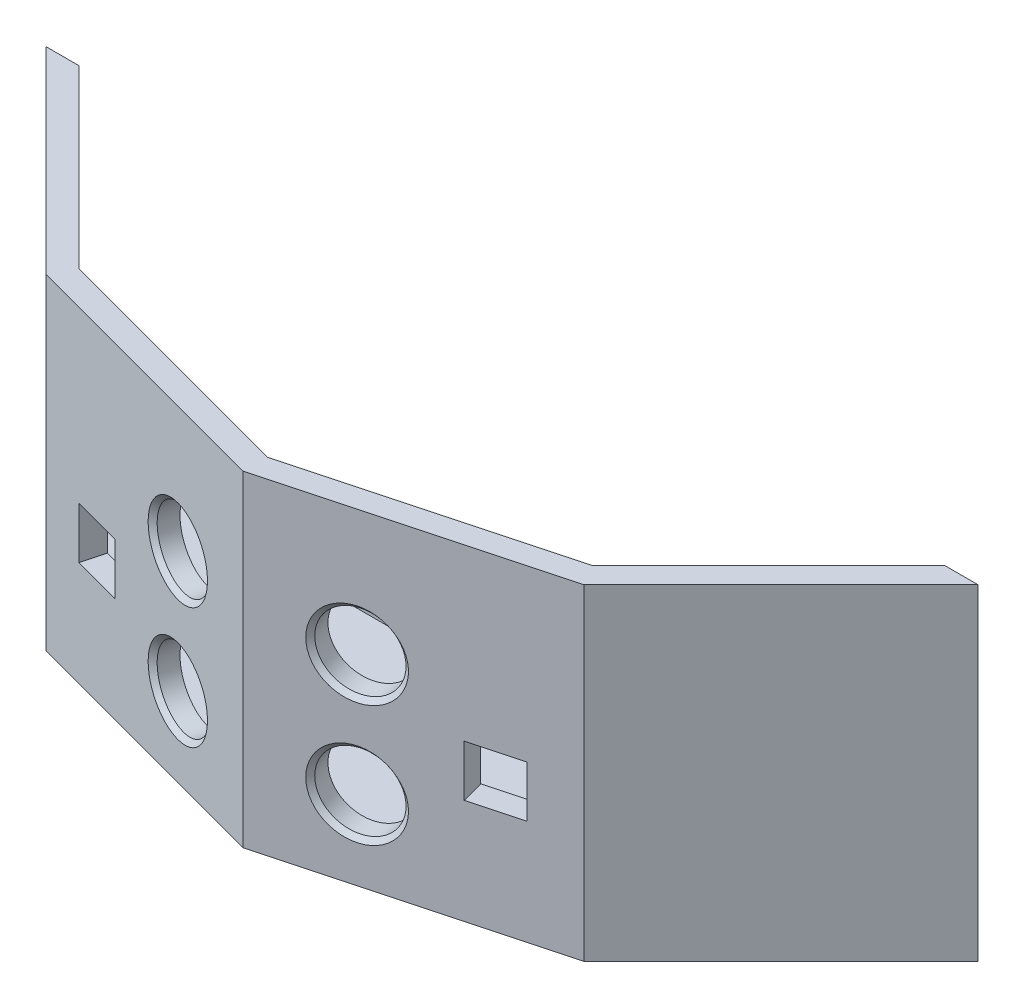
from build123d import *

# Parameters (mm, degrees)
BOSS_EXTRUDE1_DEPTH = 70
CUT_EXTRUDE1_DEPTH  = 65
SKETCH5_R           = 8
CUT_EXTRUDE2_DEPTH  = 10
SKETCH6_R           = 8
CUT_EXTRUDE3_DEPTH  = 10
CHAMFER2_SIZE       = 1
SKETCH7_W           = 11
SKETCH7_H           = 11
CUT_EXTRUDE4_DEPTH  = 10
SKETCH8_W           = 11
SKETCH8_H           = 11
CUT_EXTRUDE5_DEPTH  = 10
SKETCH9_W           = 13
SKETCH9_H           = 10
BOSS_EXTRUDE2_DEPTH = 6
SKETCH10_R          = 2
CUT_EXTRUDE6_DEPTH  = 10
FILLET1_R           = 5


with BuildPart() as part:
    # Sketch1 → Boss-Extrude1 (new body)
    with BuildSketch(Plane(origin=(0, 0, 0), x_dir=(1, 0, 0), z_dir=(0, 1, 0))):
        Polygon((57.735026919, -100), (100, -57.735026919), (-100, -57.735026919), (-57.735026919, -100), (0, -115.470053838), align=None)
    extrude(amount=BOSS_EXTRUDE1_DEPTH)

    # Sketch4 → Cut-Extrude1 (cut)
    with BuildSketch(Plane(origin=(0, 70, 0), x_dir=(1, 0, 0), z_dir=(0, 1, 0))):
        Polygon((110.293672936, 0), (95.517122639, 55.146836468), (55.146836468, 95.517122639), (0, 110.293672936), (-55.146836468, 95.517122639), (-95.517122639, 55.146836468), (-110.293672936, 0), (-95.517122639, -55.146836468), (-55.146836468, -95.517122639), (0, -110.293672936), (55.146836468, -95.517122639), (95.517122639, -55.146836468), align=None)
    extrude(amount=-CUT_EXTRUDE1_DEPTH, mode=Mode.SUBTRACT)

    # Sketch5 → Cut-Extrude2 (cut)
    with BuildSketch(Plane(origin=(-28.867513459, 0, 107.735026919), x_dir=(0.9659258262890683, 0, 0.25881904510252085), z_dir=(-0.2588190451025208, 0, 0.9659258262890682))):
        with Locations((10.114150928, 43)):
            Circle(SKETCH5_R)
        with Locations((10.114150928, 17)):
            Circle(SKETCH5_R)
    extrude(amount=-CUT_EXTRUDE2_DEPTH, mode=Mode.SUBTRACT)

    # Sketch6 → Cut-Extrude3 (cut)
    with BuildSketch(Plane(origin=(28.867513459, 0, 107.735026919), x_dir=(0.9659258262890683, 0, -0.25881904510252085), z_dir=(0.2588190451025208, 0, 0.9659258262890682))):
        with Locations((-9.885849072, 17)):
            Circle(SKETCH6_R)
        with Locations((-9.885849072, 43)):
            Circle(SKETCH6_R)
    extrude(amount=-CUT_EXTRUDE3_DEPTH, mode=Mode.SUBTRACT)

    # Chamfer2
    chamfer2_edges = [part.edges().sort_by_distance(p)[0] for p in [
        (-26.825400478, 43, 108.282209443),
        (-26.825400478, 17, 108.282209443),
        (11.591109915, 17, 112.364225297),
        (11.591109915, 43, 112.364225297),
    ]]
    chamfer(chamfer2_edges, length=CHAMFER2_SIZE)

    # Sketch7 → Cut-Extrude4 (cut)
    with BuildSketch(Plane(origin=(-28.867513459, 0, 107.735026919), x_dir=(0.9659258262890683, 0, 0.25881904510252085), z_dir=(-0.2588190451025208, 0, 0.9659258262890682))):
        with Locations((-14.385849072, 28)):
            Rectangle(SKETCH7_W, SKETCH7_H)
    extrude(amount=-CUT_EXTRUDE4_DEPTH, mode=Mode.SUBTRACT)

    # Sketch8 → Cut-Extrude5 (cut)
    with BuildSketch(Plane(origin=(28.867513459, 0, 107.735026919), x_dir=(0.9659258262890683, 0, -0.25881904510252085), z_dir=(0.2588190451025208, 0, 0.9659258262890682))):
        with Locations((14.385849072, 28)):
            Rectangle(SKETCH8_W, SKETCH8_H)
    extrude(amount=-CUT_EXTRUDE5_DEPTH, mode=Mode.SUBTRACT)

    # Sketch9 → Boss-Extrude2 (add)
    with BuildSketch(Plane(origin=(0, 0, 57.735026919), x_dir=(-1, 0, 0), z_dir=(0, 0, -1))):
        with Locations((-26.5, 10)):
            Rectangle(SKETCH9_W, SKETCH9_H)
        with Locations((26.5, 10)):
            Rectangle(SKETCH9_W, SKETCH9_H)
    extrude(amount=-BOSS_EXTRUDE2_DEPTH)

    # Sketch10 → Cut-Extrude6 (cut)
    with BuildSketch(Plane(origin=(0, 0, 57.735026919), x_dir=(-1, 0, 0), z_dir=(0, 0, -1))):
        with Locations((-26.5, 11)):
            Circle(SKETCH10_R)
        with Locations((26.5, 11)):
            Circle(SKETCH10_R)
    extrude(amount=-CUT_EXTRUDE6_DEPTH, mode=Mode.SUBTRACT)

    # Fillet1
    fillet1_edges = [part.edges().sort_by_distance(p)[0] for p in [
        (-33, 5, 60.735026919),
        (-20, 5, 60.735026919),
        (20, 5, 60.735026919),
        (33, 5, 60.735026919),
    ]]
    fillet(fillet1_edges, radius=FILLET1_R)
    fillet1_2_edges = [part.edges().sort_by_distance(p)[0] for p in [
        (-33, 15, 60.735026919),
        (-20, 15, 60.735026919),
        (20, 15, 60.735026919),
        (33, 15, 60.735026919),
    ]]
    fillet(fillet1_2_edges, radius=FILLET1_R - 0.0001)  # a hair under: the kernel refuses the full size


solid = part.part
